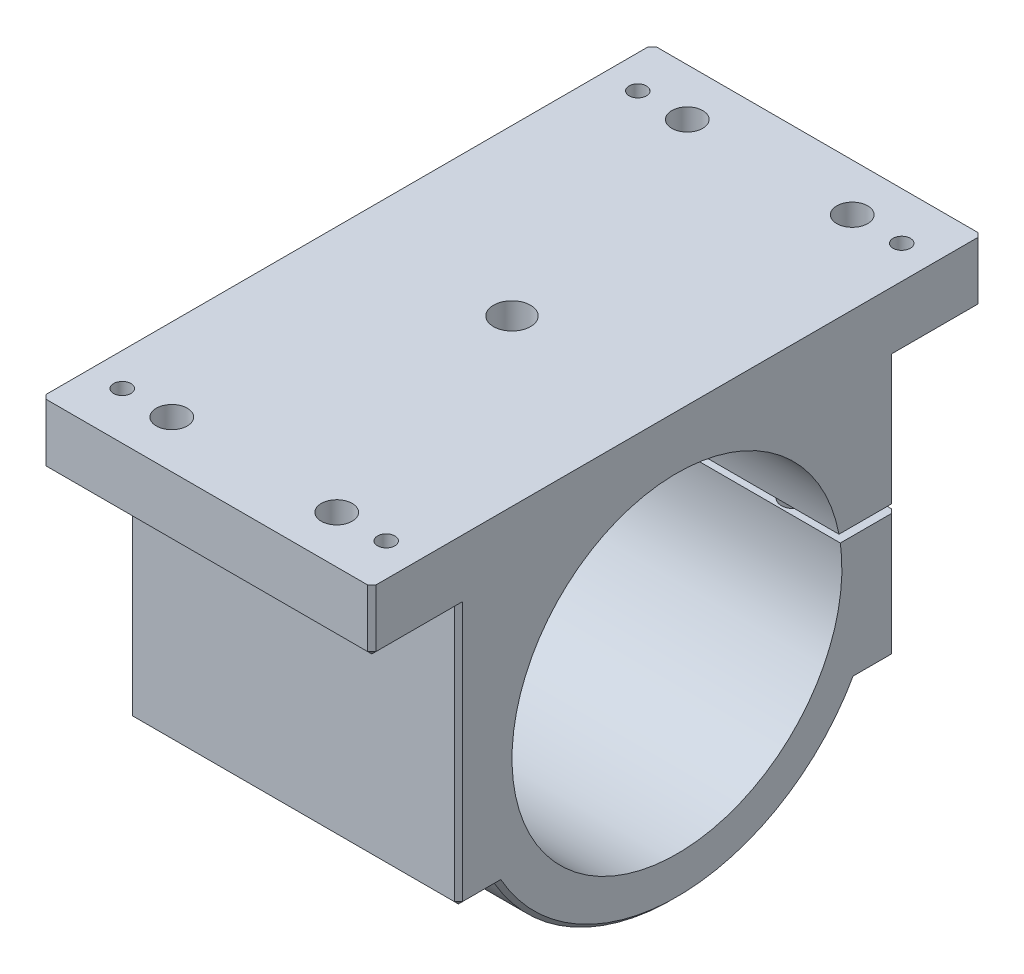
from build123d import *

# Parameters (mm, degrees)
SKETCH1_R           = 40
BOSS_EXTRUDE1_DEPTH = 40
SKETCH2_W           = 80
SKETCH2_H           = 2
CUT_EXTRUDE1_DEPTH  = 19
CUT_EXTRUDE2_START  = -3
SKETCH3_R           = 5.5
CUT_EXTRUDE2_DEPTH  = 118.717043198
SKETCH4_R           = 3
CUT_EXTRUDE3_DEPTH  = 64.5
LPATTERN1_COUNT     = 3
LPATTERN1_PITCH     = 25
SKETCH5_R           = 4.5
SKETCH5_R_2         = 2.1
SKETCH5_R_3         = 3.75
CUT_EXTRUDE4_DEPTH  = 24.5
CHAMFER1_SIZE       = 1


with BuildPart() as part:
    # Sketch1 → Boss-Extrude1 (new, symmetric)
    with BuildSketch(Plane(origin=(0, 0, 0), x_dir=(0, 0, -1), z_dir=(1, 0, 0))):
        with BuildLine():
            Line((-53, -25), (-43.301270189, -25))
            ThreePointArc((-43.301270189, -25), (0, -50), (43.301270189, -25))
            Line((43.301270189, -25), (53, -25))
            Line((53, -25), (53, 38))
            Line((53, 38), (74, 38))
            Line((74, 38), (74, 53))
            Line((74, 53), (-74, 53))
            Line((-74, 53), (-74, 38))
            Line((-74, 38), (-53, 38))
            Line((-53, 38), (-53, -25))
        make_face()
        Circle(SKETCH1_R, mode=Mode.SUBTRACT)
    extrude(amount=BOSS_EXTRUDE1_DEPTH, both=True)

    # Sketch2 → Cut-Extrude1 (cut)
    with BuildSketch(Plane(origin=(0, 0, -53), x_dir=(-1, 0, 0), z_dir=(0, 0, -1))):
        with Locations((0, 6.5)):
            Rectangle(SKETCH2_W, SKETCH2_H)
    extrude(amount=-CUT_EXTRUDE1_DEPTH, mode=Mode.SUBTRACT)

    # Sketch3 → Cut-Extrude2 (cut, through all)
    with BuildSketch(Plane.XZ.offset(25).offset(CUT_EXTRUDE2_START)):
        with Locations((25.000000054, -43.3)):
            Circle(SKETCH3_R)
    cut_extrude2 = extrude(amount=CUT_EXTRUDE2_DEPTH, mode=Mode.SUBTRACT)

    # Sketch4 → Cut-Extrude3 (cut)
    with BuildSketch(Plane.XZ.offset(22)):
        with Locations((25.000000054, -43.3)):
            Circle(SKETCH4_R)
    cut_extrude3 = extrude(amount=-CUT_EXTRUDE3_DEPTH, mode=Mode.SUBTRACT)

    # LPattern1: Cut-Extrude2, Cut-Extrude3 ×3
    with Locations(*[(-i * LPATTERN1_PITCH, 0, 0) for i in range(1, LPATTERN1_COUNT)]):
        add(cut_extrude2, mode=Mode.SUBTRACT)
        add(cut_extrude3, mode=Mode.SUBTRACT)

    # Sketch5 → Cut-Extrude4 (cut)
    with BuildSketch(Plane(origin=(0, 53, 0), x_dir=(1, 0, 0), z_dir=(0, 1, 0))):
        Circle(SKETCH5_R)
        with Locations((-32, 62.5)):
            Circle(SKETCH5_R_2)
        with Locations((-20, 62.5)):
            Circle(SKETCH5_R_3)
        with Locations((32, 62.5)):
            Circle(SKETCH5_R_2)
        with Locations((20, 62.5)):
            Circle(SKETCH5_R_3)
        with Locations((32, -62.5)):
            Circle(SKETCH5_R_2)
        with Locations((20, -62.5)):
            Circle(SKETCH5_R_3)
        with Locations((-20, -62.5)):
            Circle(SKETCH5_R_3)
        with Locations((-32, -62.5)):
            Circle(SKETCH5_R_2)
    extrude(amount=-CUT_EXTRUDE4_DEPTH, mode=Mode.SUBTRACT)

    # Chamfer1
    chamfer1_edges = [part.edges().sort_by_distance(p)[0] for p in [
        (40, 22.75, -53),
        (40, 38, -63.5),
        (40, 45.5, -74),
        (0, 38, -74),
        (-40, 45.5, -74),
        (-40, 38, -63.5),
        (-40, 22.75, -53),
        (40, 6.5, 53),
        (-40, 6.5, 53),
        (0, 38, 74),
        (40, 45.5, 74),
        (40, 38, 63.5),
        (-40, 38, 63.5),
        (-40, 45.5, 74),
        (40, -9.75, -53),
        (-40, -9.75, -53),
        (40, -25, -48.150635095),
        (0, -25, -53),
        (-40, -25, -48.150635095),
        (40, -50, 0),
        (40, -25, 48.150635095),
        (0, -25, 53),
        (-40, -25, 48.150635095),
        (-40, -50, 0),
    ]]
    chamfer(chamfer1_edges, length=CHAMFER1_SIZE)


solid = part.part
